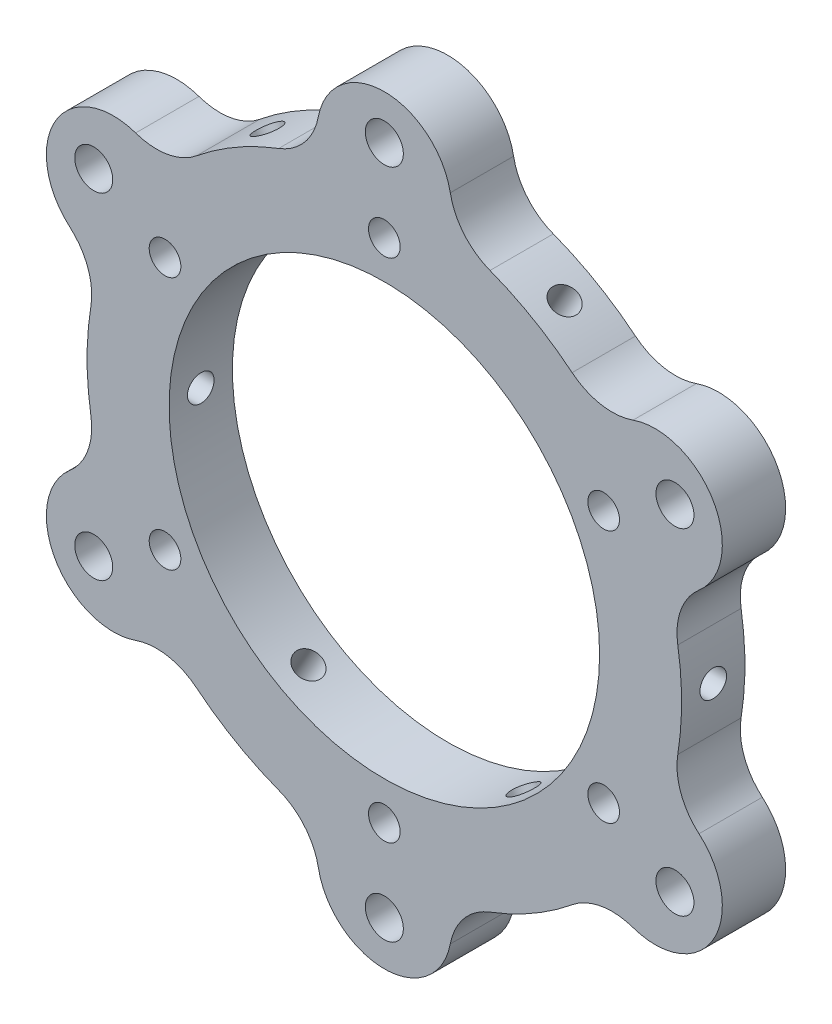
from build123d import *

# Parameters (mm, degrees)
SKETCH2_R           = 3
SKETCH2_R_2         = 2.5
SKETCH2_R_3         = 34
BOSS_EXTRUDE1_DEPTH = 10
SKETCH4_R           = 2.1
CUT_EXTRUDE1_DEPTH  = 81.929862228
CIRPATTERN1_COUNT   = 6


with BuildPart() as part:
    # Sketch2 → Boss-Extrude1 (new body)
    with BuildSketch(Plane.XY):
        with BuildLine():
            ThreePointArc((49.696632908, 16.663012041), (51.961524227, 30), (39.278908185, 34.707040561))
            ThreePointArc((39.278908185, 34.707040561), (34.249587679, 34.296880605), (29.660285602, 36.394641886))
            ThreePointArc((29.660285602, 36.394641886), (23.475, 40.659892708), (16.688541634, 43.883881758))
            ThreePointArc((16.688541634, 43.883881758), (12.577176035, 46.809453301), (10.417724723, 51.370052601))
            ThreePointArc((10.417724723, 51.370052601), (0, 60), (-10.417724723, 51.370052601))
            ThreePointArc((-10.417724723, 51.370052601), (-12.577176035, 46.809453301), (-16.688541634, 43.883881758))
            ThreePointArc((-16.688541634, 43.883881758), (-23.475, 40.659892708), (-29.660285602, 36.394641886))
            ThreePointArc((-29.660285602, 36.394641886), (-34.249587679, 34.296880605), (-39.278908185, 34.707040561))
            ThreePointArc((-39.278908185, 34.707040561), (-51.961524227, 30), (-49.696632908, 16.663012041))
            ThreePointArc((-49.696632908, 16.663012041), (-46.826763714, 12.512572696), (-46.348827236, 7.489239872))
            ThreePointArc((-46.348827236, 7.489239872), (-46.95, 0), (-46.348827236, -7.489239872))
            ThreePointArc((-46.348827236, -7.489239872), (-46.826763714, -12.512572696), (-49.696632908, -16.663012041))
            ThreePointArc((-49.696632908, -16.663012041), (-51.961524227, -30), (-39.278908185, -34.707040561))
            ThreePointArc((-39.278908185, -34.707040561), (-34.249587679, -34.296880605), (-29.660285602, -36.394641886))
            ThreePointArc((-29.660285602, -36.394641886), (-23.475, -40.659892708), (-16.688541634, -43.883881758))
            ThreePointArc((-16.688541634, -43.883881758), (-12.577176035, -46.809453301), (-10.417724723, -51.370052601))
            ThreePointArc((-10.417724723, -51.370052601), (0, -60), (10.417724723, -51.370052601))
            ThreePointArc((10.417724723, -51.370052601), (12.577176035, -46.809453301), (16.688541634, -43.883881758))
            ThreePointArc((16.688541634, -43.883881758), (23.475, -40.659892708), (29.660285602, -36.394641886))
            ThreePointArc((29.660285602, -36.394641886), (34.249587679, -34.296880605), (39.278908185, -34.707040561))
            ThreePointArc((39.278908185, -34.707040561), (51.961524227, -30), (49.696632908, -16.663012041))
            ThreePointArc((49.696632908, -16.663012041), (46.826763714, -12.512572696), (46.348827236, -7.489239872))
            ThreePointArc((46.348827236, -7.489239872), (46.95, 0), (46.348827236, 7.489239872))
            ThreePointArc((46.348827236, 7.489239872), (46.826763714, 12.512572696), (49.696632908, 16.663012041))
        make_face()
        with Locations((45.899346401, 26.5)):
            Circle(SKETCH2_R, mode=Mode.SUBTRACT)
        with Locations((0, 53)):
            Circle(SKETCH2_R, mode=Mode.SUBTRACT)
        with Locations((-34.641016151, -20)):
            Circle(SKETCH2_R_2, mode=Mode.SUBTRACT)
        with Locations((0, -40)):
            Circle(SKETCH2_R_2, mode=Mode.SUBTRACT)
        with Locations((34.641016151, -20)):
            Circle(SKETCH2_R_2, mode=Mode.SUBTRACT)
        with Locations((-34.641016151, 20)):
            Circle(SKETCH2_R_2, mode=Mode.SUBTRACT)
        with Locations((0, 40)):
            Circle(SKETCH2_R_2, mode=Mode.SUBTRACT)
        Circle(SKETCH2_R_3, mode=Mode.SUBTRACT)
        with Locations((34.641016151, 20)):
            Circle(SKETCH2_R_2, mode=Mode.SUBTRACT)
        with Locations((45.899346401, -26.5)):
            Circle(SKETCH2_R, mode=Mode.SUBTRACT)
        with Locations((0, -53)):
            Circle(SKETCH2_R, mode=Mode.SUBTRACT)
        with Locations((-45.899346401, -26.5)):
            Circle(SKETCH2_R, mode=Mode.SUBTRACT)
        with Locations((-45.899346401, 26.5)):
            Circle(SKETCH2_R, mode=Mode.SUBTRACT)
    extrude(amount=BOSS_EXTRUDE1_DEPTH)

    # Sketch4 → Cut-Extrude1 (cut, symmetric)
    with BuildSketch(Plane(origin=(0, 0, 0), x_dir=(0, 0, -1), z_dir=(-0.500000000000001, 0.866025403784438, 0))):
        with Locations((-5, 0)):
            Circle(SKETCH4_R)
    cut_extrude1 = extrude(amount=CUT_EXTRUDE1_DEPTH, both=True, mode=Mode.SUBTRACT)

    # CirPattern1: Cut-Extrude1 ×6 about axis
    cirpattern1_axis = Axis((0, 0, 16.500840286), (0, 0, -1))
    for i in range(1, CIRPATTERN1_COUNT):
        add(cut_extrude1.rotate(cirpattern1_axis, i * 360 / CIRPATTERN1_COUNT), mode=Mode.SUBTRACT)


solid = part.part
